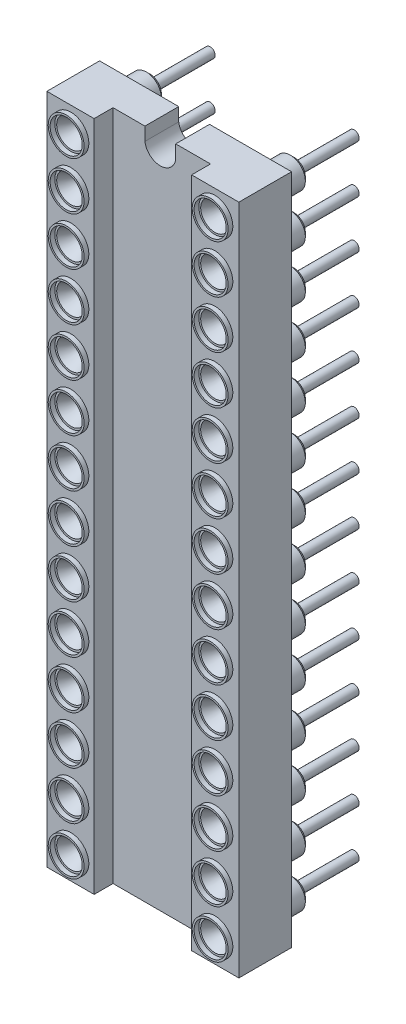
from build123d import *

# Parameters (mm, degrees)
SKETCH1_W                  = 10.16
SKETCH1_H                  = 35.56
BASE_EXTRUDE_DEPTH         = 2.79
SKETCH2_W                  = 5.16
SKETCH2_H                  = 1
CUT_EXTRUDE1_DEPTH         = 37.029211759
SKETCH4_R                  = 0.75
CUT_EXTRUDE4_DEPTH         = 1
CUT_EXTRUDE4_DRAFT         = -29.999999966
SKETCH5_R                  = 0.95
SKETCH5_R_2                = 0.85
BOSS_EXTRUDE_THIN1_DEPTH   = 0.25
SKETCH6_R                  = 0.79773641
BOSS_EXTRUDE1_DEPTH        = 1.4
SKETCH7_R                  = 0.265
BOSS_EXTRUDE2_DEPTH        = 3.18
CHAMFER1_SIZE              = 0.2
LPATTERN1_COUNT            = 14
LPATTERN1_PITCH            = 2.54
LPATTERN1_COPY_1_SKETCH_R  = 0.75
LPATTERN1_COPY_1_DEPTH     = 1
LPATTERN1_COPY_1_DRAFT     = -29.999999966
LPATTERN1_COPY_2_SKETCH_R  = 0.75
LPATTERN1_COPY_2_DEPTH     = 1
LPATTERN1_COPY_2_DRAFT     = -29.999999966
LPATTERN1_COPY_3_SKETCH_R  = 0.75
LPATTERN1_COPY_3_DEPTH     = 1
LPATTERN1_COPY_3_DRAFT     = -29.999999966
LPATTERN1_COPY_4_SKETCH_R  = 0.75
LPATTERN1_COPY_4_DEPTH     = 1
LPATTERN1_COPY_4_DRAFT     = -29.999999966
LPATTERN1_COPY_5_SKETCH_R  = 0.75
LPATTERN1_COPY_5_DEPTH     = 1
LPATTERN1_COPY_5_DRAFT     = -29.999999966
LPATTERN1_COPY_6_SKETCH_R  = 0.75
LPATTERN1_COPY_6_DEPTH     = 1
LPATTERN1_COPY_6_DRAFT     = -29.999999966
LPATTERN1_COPY_7_SKETCH_R  = 0.75
LPATTERN1_COPY_7_DEPTH     = 1
LPATTERN1_COPY_7_DRAFT     = -29.999999966
LPATTERN1_COPY_8_SKETCH_R  = 0.75
LPATTERN1_COPY_8_DEPTH     = 1
LPATTERN1_COPY_8_DRAFT     = -29.999999966
LPATTERN1_COPY_9_SKETCH_R  = 0.75
LPATTERN1_COPY_9_DEPTH     = 1
LPATTERN1_COPY_9_DRAFT     = -29.999999966
LPATTERN1_COPY_10_SKETCH_R = 0.75
LPATTERN1_COPY_10_DEPTH    = 1
LPATTERN1_COPY_10_DRAFT    = -29.999999966
LPATTERN1_COPY_11_SKETCH_R = 0.75
LPATTERN1_COPY_11_DEPTH    = 1
LPATTERN1_COPY_11_DRAFT    = -29.999999966
LPATTERN1_COPY_12_SKETCH_R = 0.75
LPATTERN1_COPY_12_DEPTH    = 1
LPATTERN1_COPY_12_DRAFT    = -29.999999966
LPATTERN1_COPY_13_SKETCH_R = 0.75
LPATTERN1_COPY_13_DEPTH    = 1
LPATTERN1_COPY_13_DRAFT    = -29.999999966
CHAMFER1_OF_LPATTERN1_SIZE = 0.2
LPATTERN2_START            = 2.79
LPATTERN2_OUTLINE_R        = 0.95
LPATTERN2_OUTLINE_R_2      = 0.85
LPATTERN2_DEPTH            = 0.25
CUT_EXTRUDE5_DEPTH         = 1.79


# Read off the part's stored shape, not the designer's step: LPattern2
with BuildPart() as part:
    # Sketch1 → Base-Extrude (new body)
    with BuildSketch(Plane.XY):
        with Locations((0, -12.7)):
            Rectangle(SKETCH1_W, SKETCH1_H)
    extrude(amount=BASE_EXTRUDE_DEPTH)

    # Sketch2 → Cut-Extrude1 (cut, through all)
    with BuildSketch(Plane(origin=(0, 5.08, 0), x_dir=(-1, 0, 0), z_dir=(0, 1, 0))):
        with Locations((0, 2.29)):
            Rectangle(SKETCH2_W, SKETCH2_H)
    extrude(amount=-CUT_EXTRUDE1_DEPTH, mode=Mode.SUBTRACT)


with BuildPart() as cut_extrude4_tool:
    # Sketch4 → Cut-Extrude4 (with draft: the straight prism first)
    with BuildSketch(Plane.XY.offset(2.79)):
        with Locations((3.81, 3.81)):
            Circle(SKETCH4_R)
    extrude(amount=-CUT_EXTRUDE4_DEPTH)
    # Cut-Extrude4: the draft: its side faces are tilted about the plane it starts from
    cut_extrude4_sides = [cut_extrude4_tool.faces().sort_by_distance(p)[0] for p in [
        (3.06, 3.81, 2.29),
    ]]
    draft(cut_extrude4_sides, Plane.XY.offset(2.79), CUT_EXTRUDE4_DRAFT)


with BuildPart() as part_1:
    add(part.part)

    # Cut-Extrude4: cut by cut_extrude4_tool
    add(cut_extrude4_tool.part, mode=Mode.SUBTRACT)

    # Sketch5 → Boss-Extrude-Thin1 (add)
    with BuildSketch(Plane.XY.offset(2.79)):
        with Locations((3.81, 3.81)):
            Circle(SKETCH5_R)
        with Locations((3.81, 3.81)):
            Circle(SKETCH5_R_2, mode=Mode.SUBTRACT)
    boss_extrude_thin1 = extrude(amount=BOSS_EXTRUDE_THIN1_DEPTH)

    # Sketch6 → Boss-Extrude1 (add)
    with BuildSketch(Plane(origin=(0, 0, 0), x_dir=(-1, 0, 0), z_dir=(0, 0, -1))):
        with Locations((-3.81, 3.81)):
            Circle(SKETCH6_R)
    boss_extrude1 = extrude(amount=BOSS_EXTRUDE1_DEPTH)

    # Sketch7 → Boss-Extrude2 (add)
    with BuildSketch(Plane(origin=(0, 0, -1.4), x_dir=(-1, 0, 0), z_dir=(0, 0, -1))):
        with Locations((-3.81, 3.81)):
            Circle(SKETCH7_R)
    boss_extrude2 = extrude(amount=BOSS_EXTRUDE2_DEPTH)

    # Chamfer1
    chamfer1_edges = [part_1.edges().sort_by_distance(p)[0] for p in [
        (4.60773641, 3.81, -1.4),
    ]]
    chamfer(chamfer1_edges, length=CHAMFER1_SIZE)

    # LPattern1: Boss-Extrude-Thin1, Boss-Extrude1, Boss-Extrude2 ×14
    with Locations(*[(0, -i * LPATTERN1_PITCH, 0) for i in range(1, LPATTERN1_COUNT)]):
        add(boss_extrude_thin1)
        add(boss_extrude1)
        add(boss_extrude2)


with BuildPart() as lpattern1_copy_1_tool:
    # LPattern1 copy 1 sketch → LPattern1 copy 1 (with draft: the straight prism first)
    with BuildSketch(Plane(origin=(0, -2.54, 2.79), x_dir=(1, 0, 0), z_dir=(0, 0, 1))):
        with Locations((3.81, 3.81)):
            Circle(LPATTERN1_COPY_1_SKETCH_R)
    extrude(amount=-LPATTERN1_COPY_1_DEPTH)
    # LPattern1 copy 1: the draft: its side faces are tilted about the plane it starts from
    lpattern1_copy_1_sides = [lpattern1_copy_1_tool.faces().sort_by_distance(p)[0] for p in [
        (3.06, 1.27, 2.29),
    ]]
    draft(lpattern1_copy_1_sides, Plane(origin=(0, -2.54, 2.79), x_dir=(1, 0, 0), z_dir=(0, 0, 1)), LPATTERN1_COPY_1_DRAFT)


with BuildPart() as part_2:
    add(part_1.part)

    # LPattern1 copy 1: cut by lpattern1_copy_1_tool
    add(lpattern1_copy_1_tool.part, mode=Mode.SUBTRACT)


with BuildPart() as lpattern1_copy_2_tool:
    # LPattern1 copy 2 sketch → LPattern1 copy 2 (with draft: the straight prism first)
    with BuildSketch(Plane(origin=(0, -5.08, 2.79), x_dir=(1, 0, 0), z_dir=(0, 0, 1))):
        with Locations((3.81, 3.81)):
            Circle(LPATTERN1_COPY_2_SKETCH_R)
    extrude(amount=-LPATTERN1_COPY_2_DEPTH)
    # LPattern1 copy 2: the draft: its side faces are tilted about the plane it starts from
    lpattern1_copy_2_sides = [lpattern1_copy_2_tool.faces().sort_by_distance(p)[0] for p in [
        (3.06, -1.27, 2.29),
    ]]
    draft(lpattern1_copy_2_sides, Plane(origin=(0, -5.08, 2.79), x_dir=(1, 0, 0), z_dir=(0, 0, 1)), LPATTERN1_COPY_2_DRAFT)


with BuildPart() as part_3:
    add(part_2.part)

    # LPattern1 copy 2: cut by lpattern1_copy_2_tool
    add(lpattern1_copy_2_tool.part, mode=Mode.SUBTRACT)


with BuildPart() as lpattern1_copy_3_tool:
    # LPattern1 copy 3 sketch → LPattern1 copy 3 (with draft: the straight prism first)
    with BuildSketch(Plane(origin=(0, -7.62, 2.79), x_dir=(1, 0, 0), z_dir=(0, 0, 1))):
        with Locations((3.81, 3.81)):
            Circle(LPATTERN1_COPY_3_SKETCH_R)
    extrude(amount=-LPATTERN1_COPY_3_DEPTH)
    # LPattern1 copy 3: the draft: its side faces are tilted about the plane it starts from
    lpattern1_copy_3_sides = [lpattern1_copy_3_tool.faces().sort_by_distance(p)[0] for p in [
        (3.06, -3.81, 2.29),
    ]]
    draft(lpattern1_copy_3_sides, Plane(origin=(0, -7.62, 2.79), x_dir=(1, 0, 0), z_dir=(0, 0, 1)), LPATTERN1_COPY_3_DRAFT)


with BuildPart() as part_4:
    add(part_3.part)

    # LPattern1 copy 3: cut by lpattern1_copy_3_tool
    add(lpattern1_copy_3_tool.part, mode=Mode.SUBTRACT)


with BuildPart() as lpattern1_copy_4_tool:
    # LPattern1 copy 4 sketch → LPattern1 copy 4 (with draft: the straight prism first)
    with BuildSketch(Plane(origin=(0, -10.16, 2.79), x_dir=(1, 0, 0), z_dir=(0, 0, 1))):
        with Locations((3.81, 3.81)):
            Circle(LPATTERN1_COPY_4_SKETCH_R)
    extrude(amount=-LPATTERN1_COPY_4_DEPTH)
    # LPattern1 copy 4: the draft: its side faces are tilted about the plane it starts from
    lpattern1_copy_4_sides = [lpattern1_copy_4_tool.faces().sort_by_distance(p)[0] for p in [
        (3.06, -6.35, 2.29),
    ]]
    draft(lpattern1_copy_4_sides, Plane(origin=(0, -10.16, 2.79), x_dir=(1, 0, 0), z_dir=(0, 0, 1)), LPATTERN1_COPY_4_DRAFT)


with BuildPart() as part_5:
    add(part_4.part)

    # LPattern1 copy 4: cut by lpattern1_copy_4_tool
    add(lpattern1_copy_4_tool.part, mode=Mode.SUBTRACT)


with BuildPart() as lpattern1_copy_5_tool:
    # LPattern1 copy 5 sketch → LPattern1 copy 5 (with draft: the straight prism first)
    with BuildSketch(Plane(origin=(0, -12.7, 2.79), x_dir=(1, 0, 0), z_dir=(0, 0, 1))):
        with Locations((3.81, 3.81)):
            Circle(LPATTERN1_COPY_5_SKETCH_R)
    extrude(amount=-LPATTERN1_COPY_5_DEPTH)
    # LPattern1 copy 5: the draft: its side faces are tilted about the plane it starts from
    lpattern1_copy_5_sides = [lpattern1_copy_5_tool.faces().sort_by_distance(p)[0] for p in [
        (3.06, -8.89, 2.29),
    ]]
    draft(lpattern1_copy_5_sides, Plane(origin=(0, -12.7, 2.79), x_dir=(1, 0, 0), z_dir=(0, 0, 1)), LPATTERN1_COPY_5_DRAFT)


with BuildPart() as part_6:
    add(part_5.part)

    # LPattern1 copy 5: cut by lpattern1_copy_5_tool
    add(lpattern1_copy_5_tool.part, mode=Mode.SUBTRACT)


with BuildPart() as lpattern1_copy_6_tool:
    # LPattern1 copy 6 sketch → LPattern1 copy 6 (with draft: the straight prism first)
    with BuildSketch(Plane(origin=(0, -15.24, 2.79), x_dir=(1, 0, 0), z_dir=(0, 0, 1))):
        with Locations((3.81, 3.81)):
            Circle(LPATTERN1_COPY_6_SKETCH_R)
    extrude(amount=-LPATTERN1_COPY_6_DEPTH)
    # LPattern1 copy 6: the draft: its side faces are tilted about the plane it starts from
    lpattern1_copy_6_sides = [lpattern1_copy_6_tool.faces().sort_by_distance(p)[0] for p in [
        (3.06, -11.43, 2.29),
    ]]
    draft(lpattern1_copy_6_sides, Plane(origin=(0, -15.24, 2.79), x_dir=(1, 0, 0), z_dir=(0, 0, 1)), LPATTERN1_COPY_6_DRAFT)


with BuildPart() as part_7:
    add(part_6.part)

    # LPattern1 copy 6: cut by lpattern1_copy_6_tool
    add(lpattern1_copy_6_tool.part, mode=Mode.SUBTRACT)


with BuildPart() as lpattern1_copy_7_tool:
    # LPattern1 copy 7 sketch → LPattern1 copy 7 (with draft: the straight prism first)
    with BuildSketch(Plane(origin=(0, -17.78, 2.79), x_dir=(1, 0, 0), z_dir=(0, 0, 1))):
        with Locations((3.81, 3.81)):
            Circle(LPATTERN1_COPY_7_SKETCH_R)
    extrude(amount=-LPATTERN1_COPY_7_DEPTH)
    # LPattern1 copy 7: the draft: its side faces are tilted about the plane it starts from
    lpattern1_copy_7_sides = [lpattern1_copy_7_tool.faces().sort_by_distance(p)[0] for p in [
        (3.06, -13.97, 2.29),
    ]]
    draft(lpattern1_copy_7_sides, Plane(origin=(0, -17.78, 2.79), x_dir=(1, 0, 0), z_dir=(0, 0, 1)), LPATTERN1_COPY_7_DRAFT)


with BuildPart() as part_8:
    add(part_7.part)

    # LPattern1 copy 7: cut by lpattern1_copy_7_tool
    add(lpattern1_copy_7_tool.part, mode=Mode.SUBTRACT)


with BuildPart() as lpattern1_copy_8_tool:
    # LPattern1 copy 8 sketch → LPattern1 copy 8 (with draft: the straight prism first)
    with BuildSketch(Plane(origin=(0, -20.32, 2.79), x_dir=(1, 0, 0), z_dir=(0, 0, 1))):
        with Locations((3.81, 3.81)):
            Circle(LPATTERN1_COPY_8_SKETCH_R)
    extrude(amount=-LPATTERN1_COPY_8_DEPTH)
    # LPattern1 copy 8: the draft: its side faces are tilted about the plane it starts from
    lpattern1_copy_8_sides = [lpattern1_copy_8_tool.faces().sort_by_distance(p)[0] for p in [
        (3.06, -16.51, 2.29),
    ]]
    draft(lpattern1_copy_8_sides, Plane(origin=(0, -20.32, 2.79), x_dir=(1, 0, 0), z_dir=(0, 0, 1)), LPATTERN1_COPY_8_DRAFT)


with BuildPart() as part_9:
    add(part_8.part)

    # LPattern1 copy 8: cut by lpattern1_copy_8_tool
    add(lpattern1_copy_8_tool.part, mode=Mode.SUBTRACT)


with BuildPart() as lpattern1_copy_9_tool:
    # LPattern1 copy 9 sketch → LPattern1 copy 9 (with draft: the straight prism first)
    with BuildSketch(Plane(origin=(0, -22.86, 2.79), x_dir=(1, 0, 0), z_dir=(0, 0, 1))):
        with Locations((3.81, 3.81)):
            Circle(LPATTERN1_COPY_9_SKETCH_R)
    extrude(amount=-LPATTERN1_COPY_9_DEPTH)
    # LPattern1 copy 9: the draft: its side faces are tilted about the plane it starts from
    lpattern1_copy_9_sides = [lpattern1_copy_9_tool.faces().sort_by_distance(p)[0] for p in [
        (3.06, -19.05, 2.29),
    ]]
    draft(lpattern1_copy_9_sides, Plane(origin=(0, -22.86, 2.79), x_dir=(1, 0, 0), z_dir=(0, 0, 1)), LPATTERN1_COPY_9_DRAFT)


with BuildPart() as part_10:
    add(part_9.part)

    # LPattern1 copy 9: cut by lpattern1_copy_9_tool
    add(lpattern1_copy_9_tool.part, mode=Mode.SUBTRACT)


with BuildPart() as lpattern1_copy_10_tool:
    # LPattern1 copy 10 sketch → LPattern1 copy 10 (with draft: the straight prism first)
    with BuildSketch(Plane(origin=(0, -25.4, 2.79), x_dir=(1, 0, 0), z_dir=(0, 0, 1))):
        with Locations((3.81, 3.81)):
            Circle(LPATTERN1_COPY_10_SKETCH_R)
    extrude(amount=-LPATTERN1_COPY_10_DEPTH)
    # LPattern1 copy 10: the draft: its side faces are tilted about the plane it starts from
    lpattern1_copy_10_sides = [lpattern1_copy_10_tool.faces().sort_by_distance(p)[0] for p in [
        (3.06, -21.59, 2.29),
    ]]
    draft(lpattern1_copy_10_sides, Plane(origin=(0, -25.4, 2.79), x_dir=(1, 0, 0), z_dir=(0, 0, 1)), LPATTERN1_COPY_10_DRAFT)


with BuildPart() as part_11:
    add(part_10.part)

    # LPattern1 copy 10: cut by lpattern1_copy_10_tool
    add(lpattern1_copy_10_tool.part, mode=Mode.SUBTRACT)


with BuildPart() as lpattern1_copy_11_tool:
    # LPattern1 copy 11 sketch → LPattern1 copy 11 (with draft: the straight prism first)
    with BuildSketch(Plane(origin=(0, -27.94, 2.79), x_dir=(1, 0, 0), z_dir=(0, 0, 1))):
        with Locations((3.81, 3.81)):
            Circle(LPATTERN1_COPY_11_SKETCH_R)
    extrude(amount=-LPATTERN1_COPY_11_DEPTH)
    # LPattern1 copy 11: the draft: its side faces are tilted about the plane it starts from
    lpattern1_copy_11_sides = [lpattern1_copy_11_tool.faces().sort_by_distance(p)[0] for p in [
        (3.06, -24.13, 2.29),
    ]]
    draft(lpattern1_copy_11_sides, Plane(origin=(0, -27.94, 2.79), x_dir=(1, 0, 0), z_dir=(0, 0, 1)), LPATTERN1_COPY_11_DRAFT)


with BuildPart() as part_12:
    add(part_11.part)

    # LPattern1 copy 11: cut by lpattern1_copy_11_tool
    add(lpattern1_copy_11_tool.part, mode=Mode.SUBTRACT)


with BuildPart() as lpattern1_copy_12_tool:
    # LPattern1 copy 12 sketch → LPattern1 copy 12 (with draft: the straight prism first)
    with BuildSketch(Plane(origin=(0, -30.48, 2.79), x_dir=(1, 0, 0), z_dir=(0, 0, 1))):
        with Locations((3.81, 3.81)):
            Circle(LPATTERN1_COPY_12_SKETCH_R)
    extrude(amount=-LPATTERN1_COPY_12_DEPTH)
    # LPattern1 copy 12: the draft: its side faces are tilted about the plane it starts from
    lpattern1_copy_12_sides = [lpattern1_copy_12_tool.faces().sort_by_distance(p)[0] for p in [
        (3.06, -26.67, 2.29),
    ]]
    draft(lpattern1_copy_12_sides, Plane(origin=(0, -30.48, 2.79), x_dir=(1, 0, 0), z_dir=(0, 0, 1)), LPATTERN1_COPY_12_DRAFT)


with BuildPart() as part_13:
    add(part_12.part)

    # LPattern1 copy 12: cut by lpattern1_copy_12_tool
    add(lpattern1_copy_12_tool.part, mode=Mode.SUBTRACT)


with BuildPart() as lpattern1_copy_13_tool:
    # LPattern1 copy 13 sketch → LPattern1 copy 13 (with draft: the straight prism first)
    with BuildSketch(Plane(origin=(0, -33.02, 2.79), x_dir=(1, 0, 0), z_dir=(0, 0, 1))):
        with Locations((3.81, 3.81)):
            Circle(LPATTERN1_COPY_13_SKETCH_R)
    extrude(amount=-LPATTERN1_COPY_13_DEPTH)
    # LPattern1 copy 13: the draft: its side faces are tilted about the plane it starts from
    lpattern1_copy_13_sides = [lpattern1_copy_13_tool.faces().sort_by_distance(p)[0] for p in [
        (3.06, -29.21, 2.29),
    ]]
    draft(lpattern1_copy_13_sides, Plane(origin=(0, -33.02, 2.79), x_dir=(1, 0, 0), z_dir=(0, 0, 1)), LPATTERN1_COPY_13_DRAFT)


with BuildPart() as part_14:
    add(part_13.part)

    # LPattern1 copy 13: cut by lpattern1_copy_13_tool
    add(lpattern1_copy_13_tool.part, mode=Mode.SUBTRACT)

    # Chamfer1 of LPattern1
    chamfer1_of_lpattern1_edges = [part_14.edges().sort_by_distance(p)[0] for p in [
        (4.60773641, 1.27, -1.4),
        (4.60773641, -1.27, -1.4),
        (4.60773641, -3.81, -1.4),
        (4.60773641, -6.35, -1.4),
        (4.60773641, -8.89, -1.4),
        (4.60773641, -11.43, -1.4),
        (4.60773641, -13.97, -1.4),
        (4.60773641, -16.51, -1.4),
        (4.60773641, -19.05, -1.4),
        (4.60773641, -21.59, -1.4),
        (4.60773641, -24.13, -1.4),
        (4.60773641, -26.67, -1.4),
        (4.60773641, -29.21, -1.4),
    ]]
    chamfer(chamfer1_of_lpattern1_edges, length=CHAMFER1_OF_LPATTERN1_SIZE)

    # LPattern2 outline → LPattern2 (add)
    # profile 1 of 14: a face of its own
    with BuildSketch(Plane.XY.offset(LPATTERN2_START)):
        with Locations((-3.81, 3.81)):
            Circle(LPATTERN2_OUTLINE_R)
        with Locations((-3.81, 3.81)):
            Circle(LPATTERN2_OUTLINE_R_2, mode=Mode.SUBTRACT)
    # profile 2 of 14: a face of its own
    with BuildSketch(Plane.XY.offset(LPATTERN2_START)):
        with Locations((-3.81, 1.27)):
            Circle(LPATTERN2_OUTLINE_R)
        with Locations((-3.81, 1.27)):
            Circle(LPATTERN2_OUTLINE_R_2, mode=Mode.SUBTRACT)
    # profile 3 of 14: a face of its own
    with BuildSketch(Plane.XY.offset(LPATTERN2_START)):
        with Locations((-3.81, -1.27)):
            Circle(LPATTERN2_OUTLINE_R)
        with Locations((-3.81, -1.27)):
            Circle(LPATTERN2_OUTLINE_R_2, mode=Mode.SUBTRACT)
    # profile 4 of 14: a face of its own
    with BuildSketch(Plane.XY.offset(LPATTERN2_START)):
        with Locations((-3.81, -3.81)):
            Circle(LPATTERN2_OUTLINE_R)
        with Locations((-3.81, -3.81)):
            Circle(LPATTERN2_OUTLINE_R_2, mode=Mode.SUBTRACT)
    # profile 5 of 14: a face of its own
    with BuildSketch(Plane.XY.offset(LPATTERN2_START)):
        with Locations((-3.81, -6.35)):
            Circle(LPATTERN2_OUTLINE_R)
        with Locations((-3.81, -6.35)):
            Circle(LPATTERN2_OUTLINE_R_2, mode=Mode.SUBTRACT)
    # profile 6 of 14: a face of its own
    with BuildSketch(Plane.XY.offset(LPATTERN2_START)):
        with Locations((-3.81, -8.89)):
            Circle(LPATTERN2_OUTLINE_R)
        with Locations((-3.81, -8.89)):
            Circle(LPATTERN2_OUTLINE_R_2, mode=Mode.SUBTRACT)
    # profile 7 of 14: a face of its own
    with BuildSketch(Plane.XY.offset(LPATTERN2_START)):
        with Locations((-3.81, -11.43)):
            Circle(LPATTERN2_OUTLINE_R)
        with Locations((-3.81, -11.43)):
            Circle(LPATTERN2_OUTLINE_R_2, mode=Mode.SUBTRACT)
    # profile 8 of 14: a face of its own
    with BuildSketch(Plane.XY.offset(LPATTERN2_START)):
        with Locations((-3.81, -13.97)):
            Circle(LPATTERN2_OUTLINE_R)
        with Locations((-3.81, -13.97)):
            Circle(LPATTERN2_OUTLINE_R_2, mode=Mode.SUBTRACT)
    # profile 9 of 14: a face of its own
    with BuildSketch(Plane.XY.offset(LPATTERN2_START)):
        with Locations((-3.81, -16.51)):
            Circle(LPATTERN2_OUTLINE_R)
        with Locations((-3.81, -16.51)):
            Circle(LPATTERN2_OUTLINE_R_2, mode=Mode.SUBTRACT)
    # profile 10 of 14: a face of its own
    with BuildSketch(Plane.XY.offset(LPATTERN2_START)):
        with Locations((-3.81, -19.05)):
            Circle(LPATTERN2_OUTLINE_R)
        with Locations((-3.81, -19.05)):
            Circle(LPATTERN2_OUTLINE_R_2, mode=Mode.SUBTRACT)
    # profile 11 of 14: a face of its own
    with BuildSketch(Plane.XY.offset(LPATTERN2_START)):
        with Locations((-3.81, -21.59)):
            Circle(LPATTERN2_OUTLINE_R)
        with Locations((-3.81, -21.59)):
            Circle(LPATTERN2_OUTLINE_R_2, mode=Mode.SUBTRACT)
    # profile 12 of 14: a face of its own
    with BuildSketch(Plane.XY.offset(LPATTERN2_START)):
        with Locations((-3.81, -24.13)):
            Circle(LPATTERN2_OUTLINE_R)
        with Locations((-3.81, -24.13)):
            Circle(LPATTERN2_OUTLINE_R_2, mode=Mode.SUBTRACT)
    # profile 13 of 14: a face of its own
    with BuildSketch(Plane.XY.offset(LPATTERN2_START)):
        with Locations((-3.81, -26.67)):
            Circle(LPATTERN2_OUTLINE_R)
        with Locations((-3.81, -26.67)):
            Circle(LPATTERN2_OUTLINE_R_2, mode=Mode.SUBTRACT)
    # profile 14 of 14: a face of its own
    with BuildSketch(Plane.XY.offset(LPATTERN2_START)):
        with Locations((-3.81, -29.21)):
            Circle(LPATTERN2_OUTLINE_R)
        with Locations((-3.81, -29.21)):
            Circle(LPATTERN2_OUTLINE_R_2, mode=Mode.SUBTRACT)
    extrude(amount=LPATTERN2_DEPTH)

    # LPattern2 2 outline → LPattern2 2 (revolve)
    with BuildSketch(Plane(origin=(-3.81, -29.21, 0), x_dir=(1, 0, 0), z_dir=(0, -1, 0))):
        Polygon((0, 0), (0, -4.58), (0.265, -4.58), (0.265, -1.4), (0.59773641, -1.4), (0.79773641, -1.2), (0.79773641, 0), align=None)
    revolve(axis=Axis((-3.81, -29.21, 0), (0, 0, 1)))

    # LPattern2 3 outline → LPattern2 3 (revolve)
    with BuildSketch(Plane(origin=(-3.81, -26.67, 0), x_dir=(1, 0, 0), z_dir=(0, -1, 0))):
        Polygon((0, 0), (0, -4.58), (0.265, -4.58), (0.265, -1.4), (0.59773641, -1.4), (0.79773641, -1.2), (0.79773641, 0), align=None)
    revolve(axis=Axis((-3.81, -26.67, 0), (0, 0, 1)))

    # LPattern2 4 outline → LPattern2 4 (revolve)
    with BuildSketch(Plane(origin=(-3.81, -24.13, 0), x_dir=(1, 0, 0), z_dir=(0, -1, 0))):
        Polygon((0, 0), (0, -4.58), (0.265, -4.58), (0.265, -1.4), (0.59773641, -1.4), (0.79773641, -1.2), (0.79773641, 0), align=None)
    revolve(axis=Axis((-3.81, -24.13, 0), (0, 0, 1)))

    # LPattern2 5 outline → LPattern2 5 (revolve)
    with BuildSketch(Plane(origin=(-3.81, -21.59, 0), x_dir=(1, 0, 0), z_dir=(0, -1, 0))):
        Polygon((0, 0), (0, -4.58), (0.265, -4.58), (0.265, -1.4), (0.59773641, -1.4), (0.79773641, -1.2), (0.79773641, 0), align=None)
    revolve(axis=Axis((-3.81, -21.59, 0), (0, 0, 1)))

    # LPattern2 6 outline → LPattern2 6 (revolve)
    with BuildSketch(Plane(origin=(-3.81, -19.05, 0), x_dir=(1, 0, 0), z_dir=(0, -1, 0))):
        Polygon((0, 0), (0, -4.58), (0.265, -4.58), (0.265, -1.4), (0.59773641, -1.4), (0.79773641, -1.2), (0.79773641, 0), align=None)
    revolve(axis=Axis((-3.81, -19.05, 0), (0, 0, 1)))

    # LPattern2 7 outline → LPattern2 7 (revolve)
    with BuildSketch(Plane(origin=(-3.81, -16.51, 0), x_dir=(1, 0, 0), z_dir=(0, -1, 0))):
        Polygon((0, 0), (0, -4.58), (0.265, -4.58), (0.265, -1.4), (0.59773641, -1.4), (0.79773641, -1.2), (0.79773641, 0), align=None)
    revolve(axis=Axis((-3.81, -16.51, 0), (0, 0, 1)))

    # LPattern2 8 outline → LPattern2 8 (revolve)
    with BuildSketch(Plane(origin=(-3.81, -13.97, 0), x_dir=(1, 0, 0), z_dir=(0, -1, 0))):
        Polygon((0, 0), (0, -4.58), (0.265, -4.58), (0.265, -1.4), (0.59773641, -1.4), (0.79773641, -1.2), (0.79773641, 0), align=None)
    revolve(axis=Axis((-3.81, -13.97, 0), (0, 0, 1)))

    # LPattern2 9 outline → LPattern2 9 (revolve)
    with BuildSketch(Plane(origin=(-3.81, -11.43, 0), x_dir=(1, 0, 0), z_dir=(0, -1, 0))):
        Polygon((0, 0), (0, -4.58), (0.265, -4.58), (0.265, -1.4), (0.59773641, -1.4), (0.79773641, -1.2), (0.79773641, 0), align=None)
    revolve(axis=Axis((-3.81, -11.43, 0), (0, 0, 1)))

    # LPattern2 10 outline → LPattern2 10 (revolve)
    with BuildSketch(Plane(origin=(-3.81, -8.89, 0), x_dir=(1, 0, 0), z_dir=(0, -1, 0))):
        Polygon((0, 0), (0, -4.58), (0.265, -4.58), (0.265, -1.4), (0.59773641, -1.4), (0.79773641, -1.2), (0.79773641, 0), align=None)
    revolve(axis=Axis((-3.81, -8.89, 0), (0, 0, 1)))

    # LPattern2 11 outline → LPattern2 11 (revolve)
    with BuildSketch(Plane(origin=(-3.81, -6.35, 0), x_dir=(1, 0, 0), z_dir=(0, -1, 0))):
        Polygon((0, 0), (0, -4.58), (0.265, -4.58), (0.265, -1.4), (0.59773641, -1.4), (0.79773641, -1.2), (0.79773641, 0), align=None)
    revolve(axis=Axis((-3.81, -6.35, 0), (0, 0, 1)))

    # LPattern2 12 outline → LPattern2 12 (revolve)
    with BuildSketch(Plane(origin=(-3.81, -3.81, 0), x_dir=(1, 0, 0), z_dir=(0, -1, 0))):
        Polygon((0, 0), (0, -4.58), (0.265, -4.58), (0.265, -1.4), (0.59773641, -1.4), (0.79773641, -1.2), (0.79773641, 0), align=None)
    revolve(axis=Axis((-3.81, -3.81, 0), (0, 0, 1)))

    # LPattern2 13 outline → LPattern2 13 (revolve)
    with BuildSketch(Plane(origin=(-3.81, -1.27, 0), x_dir=(1, 0, 0), z_dir=(0, -1, 0))):
        Polygon((0, 0), (0, -4.58), (0.265, -4.58), (0.265, -1.4), (0.59773641, -1.4), (0.79773641, -1.2), (0.79773641, 0), align=None)
    revolve(axis=Axis((-3.81, -1.27, 0), (0, 0, 1)))

    # LPattern2 14 outline → LPattern2 14 (revolve)
    with BuildSketch(Plane(origin=(-3.81, 1.27, 0), x_dir=(1, 0, 0), z_dir=(0, -1, 0))):
        Polygon((0, 0), (0, -4.58), (0.265, -4.58), (0.265, -1.4), (0.59773641, -1.4), (0.79773641, -1.2), (0.79773641, 0), align=None)
    revolve(axis=Axis((-3.81, 1.27, 0), (0, 0, 1)))

    # LPattern2 15 outline → LPattern2 15 (revolve)
    with BuildSketch(Plane(origin=(-3.81, 3.81, 0), x_dir=(1, 0, 0), z_dir=(0, -1, 0))):
        Polygon((0, 0), (0, -4.58), (0.265, -4.58), (0.265, -1.4), (0.59773641, -1.4), (0.79773641, -1.2), (0.79773641, 0), align=None)
    revolve(axis=Axis((-3.81, 3.81, 0), (0, 0, 1)))

    # LPattern2 16 outline → LPattern2 16 (revolve, cut)
    with BuildSketch(Plane(origin=(-3.81, -29.21, 0), x_dir=(1, 0, 0), z_dir=(0, -1, 0))):
        Polygon((0.75, 2.79), (0, 2.79), (0, 1.79), (0.172649732, 1.79), align=None)
    revolve(axis=Axis((-3.81, -29.21, 0), (0, 0, 1)), mode=Mode.SUBTRACT)

    # LPattern2 17 outline → LPattern2 17 (revolve, cut)
    with BuildSketch(Plane(origin=(-3.81, -26.67, 0), x_dir=(1, 0, 0), z_dir=(0, -1, 0))):
        Polygon((0.75, 2.79), (0, 2.79), (0, 1.79), (0.172649732, 1.79), align=None)
    revolve(axis=Axis((-3.81, -26.67, 0), (0, 0, 1)), mode=Mode.SUBTRACT)

    # LPattern2 18 outline → LPattern2 18 (revolve, cut)
    with BuildSketch(Plane(origin=(-3.81, -24.13, 0), x_dir=(1, 0, 0), z_dir=(0, -1, 0))):
        Polygon((0.75, 2.79), (0, 2.79), (0, 1.79), (0.172649732, 1.79), align=None)
    revolve(axis=Axis((-3.81, -24.13, 0), (0, 0, 1)), mode=Mode.SUBTRACT)

    # LPattern2 19 outline → LPattern2 19 (revolve, cut)
    with BuildSketch(Plane(origin=(-3.81, -21.59, 0), x_dir=(1, 0, 0), z_dir=(0, -1, 0))):
        Polygon((0.75, 2.79), (0, 2.79), (0, 1.79), (0.172649732, 1.79), align=None)
    revolve(axis=Axis((-3.81, -21.59, 0), (0, 0, 1)), mode=Mode.SUBTRACT)

    # LPattern2 20 outline → LPattern2 20 (revolve, cut)
    with BuildSketch(Plane(origin=(-3.81, -19.05, 0), x_dir=(1, 0, 0), z_dir=(0, -1, 0))):
        Polygon((0.75, 2.79), (0, 2.79), (0, 1.79), (0.172649732, 1.79), align=None)
    revolve(axis=Axis((-3.81, -19.05, 0), (0, 0, 1)), mode=Mode.SUBTRACT)

    # LPattern2 21 outline → LPattern2 21 (revolve, cut)
    with BuildSketch(Plane(origin=(-3.81, -16.51, 0), x_dir=(1, 0, 0), z_dir=(0, -1, 0))):
        Polygon((0.75, 2.79), (0, 2.79), (0, 1.79), (0.172649732, 1.79), align=None)
    revolve(axis=Axis((-3.81, -16.51, 0), (0, 0, 1)), mode=Mode.SUBTRACT)

    # LPattern2 22 outline → LPattern2 22 (revolve, cut)
    with BuildSketch(Plane(origin=(-3.81, -13.97, 0), x_dir=(1, 0, 0), z_dir=(0, -1, 0))):
        Polygon((0.75, 2.79), (0, 2.79), (0, 1.79), (0.172649732, 1.79), align=None)
    revolve(axis=Axis((-3.81, -13.97, 0), (0, 0, 1)), mode=Mode.SUBTRACT)

    # LPattern2 23 outline → LPattern2 23 (revolve, cut)
    with BuildSketch(Plane(origin=(-3.81, -11.43, 0), x_dir=(1, 0, 0), z_dir=(0, -1, 0))):
        Polygon((0.75, 2.79), (0, 2.79), (0, 1.79), (0.172649732, 1.79), align=None)
    revolve(axis=Axis((-3.81, -11.43, 0), (0, 0, 1)), mode=Mode.SUBTRACT)

    # LPattern2 24 outline → LPattern2 24 (revolve, cut)
    with BuildSketch(Plane(origin=(-3.81, -8.89, 0), x_dir=(1, 0, 0), z_dir=(0, -1, 0))):
        Polygon((0.75, 2.79), (0, 2.79), (0, 1.79), (0.172649732, 1.79), align=None)
    revolve(axis=Axis((-3.81, -8.89, 0), (0, 0, 1)), mode=Mode.SUBTRACT)

    # LPattern2 25 outline → LPattern2 25 (revolve, cut)
    with BuildSketch(Plane(origin=(-3.81, -6.35, 0), x_dir=(1, 0, 0), z_dir=(0, -1, 0))):
        Polygon((0.75, 2.79), (0, 2.79), (0, 1.79), (0.172649732, 1.79), align=None)
    revolve(axis=Axis((-3.81, -6.35, 0), (0, 0, 1)), mode=Mode.SUBTRACT)

    # LPattern2 26 outline → LPattern2 26 (revolve, cut)
    with BuildSketch(Plane(origin=(-3.81, -3.81, 0), x_dir=(1, 0, 0), z_dir=(0, -1, 0))):
        Polygon((0.75, 2.79), (0, 2.79), (0, 1.79), (0.172649732, 1.79), align=None)
    revolve(axis=Axis((-3.81, -3.81, 0), (0, 0, 1)), mode=Mode.SUBTRACT)

    # LPattern2 27 outline → LPattern2 27 (revolve, cut)
    with BuildSketch(Plane(origin=(-3.81, -1.27, 0), x_dir=(1, 0, 0), z_dir=(0, -1, 0))):
        Polygon((0.75, 2.79), (0, 2.79), (0, 1.79), (0.172649732, 1.79), align=None)
    revolve(axis=Axis((-3.81, -1.27, 0), (0, 0, 1)), mode=Mode.SUBTRACT)

    # LPattern2 28 outline → LPattern2 28 (revolve, cut)
    with BuildSketch(Plane(origin=(-3.81, 1.27, 0), x_dir=(1, 0, 0), z_dir=(0, -1, 0))):
        Polygon((0.75, 2.79), (0, 2.79), (0, 1.79), (0.172649732, 1.79), align=None)
    revolve(axis=Axis((-3.81, 1.27, 0), (0, 0, 1)), mode=Mode.SUBTRACT)

    # LPattern2 29 outline → LPattern2 29 (revolve, cut)
    with BuildSketch(Plane(origin=(-3.81, 3.81, 0), x_dir=(1, 0, 0), z_dir=(0, -1, 0))):
        Polygon((0.75, 2.79), (0, 2.79), (0, 1.79), (0.172649732, 1.79), align=None)
    revolve(axis=Axis((-3.81, 3.81, 0), (0, 0, 1)), mode=Mode.SUBTRACT)

    # Sketch8 → Cut-Extrude5 (cut)
    with BuildSketch(Plane.XY.offset(1.79)):
        with BuildLine():
            Line((-0.89224895, 5.08), (0.73707522, 5.08))
            Line((0.73707522, 5.08), (0.73707522, 4.377192313))
            ThreePointArc((0.73707522, 4.377192313), (-0.077586865, 3.665063512), (-0.89224895, 4.377192313))
            Line((-0.89224895, 4.377192313), (-0.89224895, 5.08))
        make_face()
    extrude(amount=-CUT_EXTRUDE5_DEPTH, mode=Mode.SUBTRACT)


solid = part_14.part
